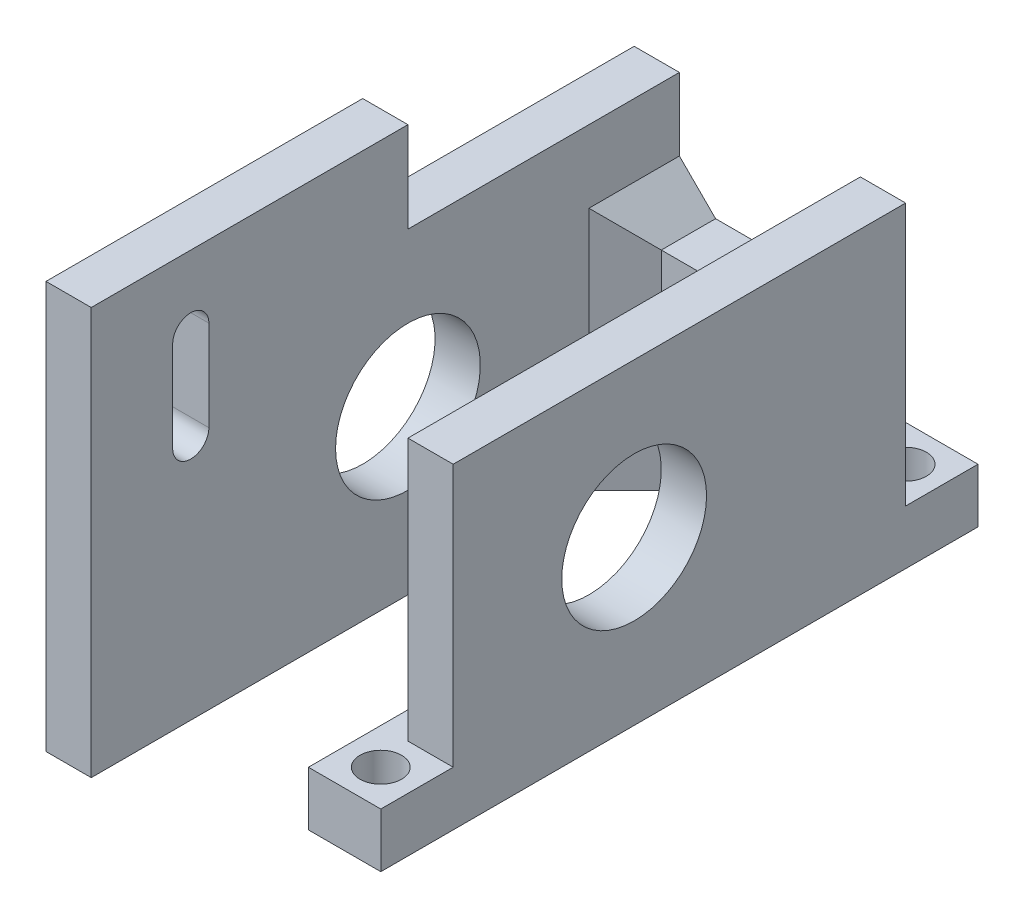
from build123d import *

# Parameters (mm, degrees)
BOSS_EXTRU_1_DEPTH      = 35
BOSS_EXTRU_7_DEPTH      = 8
ESQUISSE1_8_W           = 8
ESQUISSE1_8_H           = 8
ESQUISSE1_8_R           = 2.3
BOSS_EXTRU_8_DEPTH      = 6
BOSS_EXTRU_9_DEPTH      = 35
ENL_V_MAT_EXTRU_5_DEPTH = 35
ESQUISSE8_R             = 8
ENL_V_MAT_EXTRU_6_DEPTH = 50
BOSS_EXTRU_10_DEPTH     = 5
ENL_V_MAT_EXTRU_7_DEPTH = 5


with BuildPart() as part:
    # Esquisse1 → Boss.-Extru.1 (new body)
    with BuildSketch(Plane(origin=(0, 0, 0), x_dir=(1, 0, 0), z_dir=(0, 1, 0))):
        Polygon((-18, 9), (-23, 9), (-23, 3), (-23, 1), (-23, -33), (-23, -41), (-18, -41), (-18, 3), (2, 3), (2, -37), (2, -41), (7, -41), (7, 3), (7, 9), (2, 9), (-1, 9), align=None)
    extrude(amount=BOSS_EXTRU_1_DEPTH)

    # Esquisse1<6> → Boss.-Extru.7 (add)
    with BuildSketch(Plane(origin=(0, 0, 0), x_dir=(1, 0, 0), z_dir=(0, 1, 0))):
        Polygon((-18, 9), (-23, 9), (-23, 3), (-23, 1), (-23, -33), (-23, -41), (-18, -41), (-18, 3), (2, 3), (2, -37), (2, -41), (7, -41), (7, 3), (7, 9), (2, 9), (-1, 9), align=None)
    extrude(amount=BOSS_EXTRU_7_DEPTH)

    # Esquisse1<8> → Boss.-Extru.8 (add)
    # profile 1 of 4: a face of its own
    with BuildSketch(Plane(origin=(0, 0, 0), x_dir=(1, 0, 0), z_dir=(0, 1, 0))):
        with Locations((-27, 5)):
            Rectangle(ESQUISSE1_8_W, ESQUISSE1_8_H)
        with Locations((-27, 5)):
            Circle(ESQUISSE1_8_R, mode=Mode.SUBTRACT)
    # profile 2 of 4: a face of its own
    with BuildSketch(Plane(origin=(0, 0, 0), x_dir=(1, 0, 0), z_dir=(0, 1, 0))):
        with Locations((3, 13)):
            Rectangle(ESQUISSE1_8_W, ESQUISSE1_8_H)
        with Locations((3, 13)):
            Circle(ESQUISSE1_8_R, mode=Mode.SUBTRACT)
    # profile 3 of 4: a face of its own
    with BuildSketch(Plane(origin=(0, 0, 0), x_dir=(1, 0, 0), z_dir=(0, 1, 0))):
        with Locations((-27, -37)):
            Rectangle(ESQUISSE1_8_W, ESQUISSE1_8_H)
        with Locations((-27, -37)):
            Circle(ESQUISSE1_8_R, mode=Mode.SUBTRACT)
    # profile 4 of 4: a face of its own
    with BuildSketch(Plane(origin=(0, 0, 0), x_dir=(1, 0, 0), z_dir=(0, 1, 0))):
        Polygon((7, -49), (7, -41), (2, -41), (2, -37), (-1, -37), (-1, -49), align=None)
        with Locations((3, -45)):
            Circle(ESQUISSE1_8_R, mode=Mode.SUBTRACT)
    extrude(amount=BOSS_EXTRU_8_DEPTH)

    # Esquisse6 → Boss.-Extru.9 (add)
    with BuildSketch(Plane.XZ):
        Polygon((-18, -3), (-14, -3), (-18, 1), align=None)
        Polygon((2, -3), (-2, -3), (2, 1), align=None)
    extrude(amount=-BOSS_EXTRU_9_DEPTH)

    # Esquisse7 → Enlèv. mat.-Extru.5 (cut)
    with BuildSketch(Plane(origin=(0, 0, -9), x_dir=(-1, 0, 0), z_dir=(0, 0, -1))):
        Polygon((18, 35), (-2, 35), (-2, 27), (2, 23), (14, 23), (18, 27), align=None)
    extrude(amount=-ENL_V_MAT_EXTRU_5_DEPTH, mode=Mode.SUBTRACT)

    # Esquisse8 → Enlèv. mat.-Extru.6 (cut)
    with BuildSketch(Plane.ZY.offset(23)):
        with Locations((21, 18)):
            Circle(ESQUISSE8_R)
    extrude(amount=-ENL_V_MAT_EXTRU_6_DEPTH, mode=Mode.SUBTRACT)

    # Esquisse9 → Boss.-Extru.10 (add)
    with BuildSketch(Plane.ZY.offset(23)):
        Polygon((56, 0), (56, 45), (21, 45), (21, 35), (41, 35), (41, 0), align=None)
    extrude(amount=-BOSS_EXTRU_10_DEPTH)

    # Esquisse10 → Enlèv. mat.-Extru.7 (cut)
    with BuildSketch(Plane.ZY.offset(23)):
        with BuildLine():
            Line((47, 27), (47, 37))
            ThreePointArc((47, 37), (45, 39), (43, 37))
            Line((43, 37), (43, 27))
            ThreePointArc((43, 27), (45, 25), (47, 27))
        make_face()
    extrude(amount=-ENL_V_MAT_EXTRU_7_DEPTH, mode=Mode.SUBTRACT)


solid = part.part
